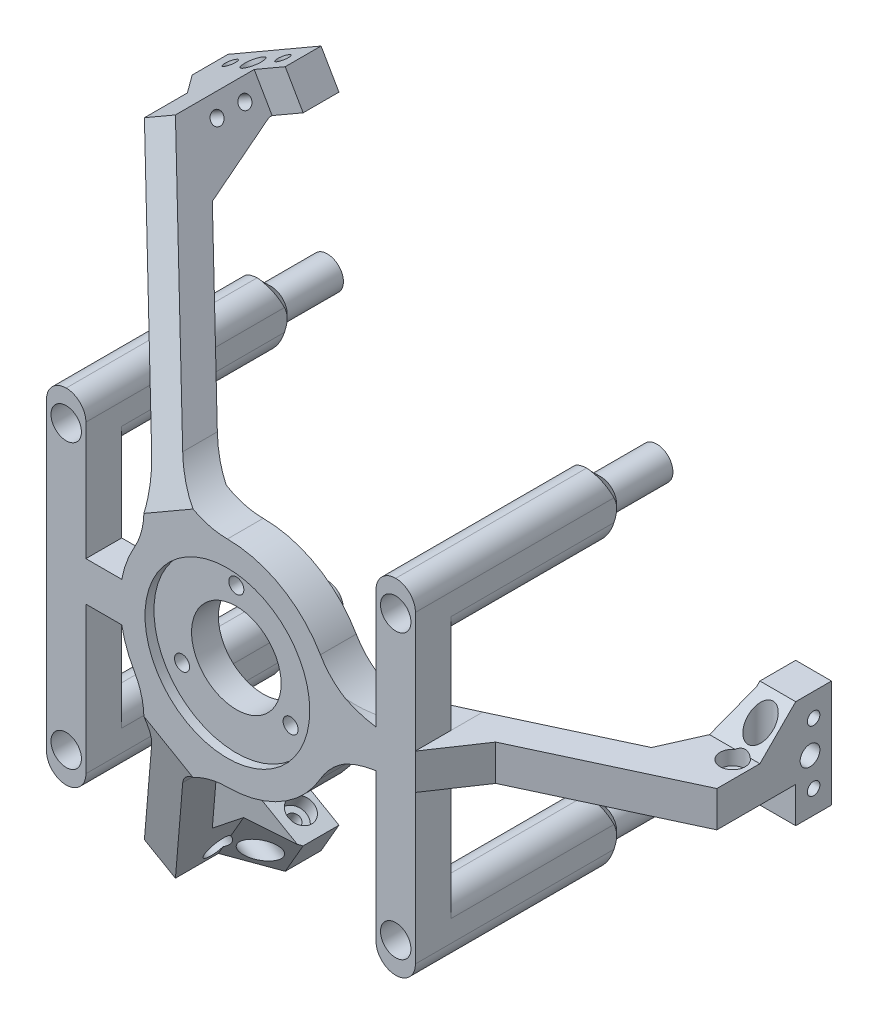
from build123d import *
from OCP.BRepFilletAPI import BRepFilletAPI_MakeChamfer

# Parameters (mm, degrees)
ESQUISSE1_W                    = 10
ESQUISSE1_H                    = 30
BOSS_EXTRU_1_DEPTH             = 10
BOSS_EXTRU_1_2_DEPTH           = 10
BOSS_EXTRU_1_3_DEPTH           = 10
ESQUISSE2_W                    = 10
ESQUISSE2_H                    = 10
BOSS_EXTRU_2_DEPTH             = 45
BOSS_EXTRU_3_DEPTH             = 10
CHANFREIN1_SIZE                = 28
CHANFREIN1_SIZE2               = 60.046193774
CHANFREIN2_SIZE                = 33
CHANFREIN2_SIZE2               = 70.768728377
CONG_1_R                       = 20
CHANFREIN4_SIZE                = 10
CHANFREIN4_SIZE2               = 16.129823564
ENL_V_MAT_EXTRU_1_REACH        = 158.32
ESQUISSE4_R                    = 12.5
ESQUISSE5_R                    = 23
ENL_V_MAT_EXTRU_2_DEPTH        = 2.5
ENL_V_MAT_EXTRU_3_REACH        = 157.297
ESQUISSE6_R                    = 2.1
ESQUISSE7_W                    = 11
ESQUISSE7_H                    = 96
BOSS_EXTRU_4_DEPTH             = 43.3
BOSS_EXTRU_4_DIRECTION_2_REACH = 154.434
ENL_V_MAT_EXTRU_4_REACH        = 153.829
ESQUISSE8_R                    = 4.25
ESQUISSE18_R                   = 4.5
ESQUISSE18_R_2                 = 2.5
BOSS_EXTRU_6_DEPTH             = 17.6
CHANFREIN3_SIZE                = 3.9
ESQUISSE19_R                   = 4.5
ESQUISSE19_R_2                 = 1.5
BOSS_EXTRU_7_DEPTH             = 2
ESQUISSE10_W                   = 21.008475794
ESQUISSE10_H                   = 62
ESQUISSE10_W_2                 = 11
ENL_V_MAT_EXTRU_6_DEPTH        = 43.3
BOSS_EXTRU_5_REACH             = 157.459
CONG_2_R                       = 5.5
BOSS_EXTRU_8_REACH             = 157.122
CHANFREIN6_SIZE                = 10
CHANFREIN6_SIZE_2              = 9.210382888
ENL_V_MAT_EXTRU_7_REACH        = 157.079
ESQUISSE11_R                   = 1.75
ESQUISSE12_R                   = 3.5
ENL_V_MAT_EXTRU_8_DEPTH        = 4
ENL_V_MAT_EXTRU_9_REACH        = 244.289
ESQUISSE13_R                   = 1.75
ESQUISSE14_R                   = 3.5
ENL_V_MAT_EXTRU_10_DEPTH       = 4
ENL_V_MAT_EXTRU_11_REACH       = 244.289
ESQUISSE15_R                   = 2.75
R_P_TITION_CIRCULAIRE1_COUNT   = 3
CHANFREIN5_SIZE                = 10


# Some blends are built 0.0001 mm under size
with BuildPart() as part:
    # Esquisse1 → Boss.-Extru.1 (new body)
    with BuildSketch(Plane.XY):
        with Locations((98.67, 0)):
            Rectangle(ESQUISSE1_W, ESQUISSE1_H)
    extrude(amount=BOSS_EXTRU_1_DEPTH)



with BuildPart() as body_2:
    # Esquisse1 → Boss.-Extru.1 2 (new body)
    with BuildSketch(Plane.XY):
        Polygon((-33.844618943, -88.620599572), (-59.825381057, -73.620599572), (-64.825381057, -82.28085361), (-38.844618943, -97.28085361), align=None)
    extrude(amount=BOSS_EXTRU_1_2_DEPTH)


with BuildPart() as body_3:
    # Esquisse1 → Boss.-Extru.1 3 (new body)
    with BuildSketch(Plane.XY):
        Polygon((-59.825381057, 73.620599572), (-33.844618943, 88.620599572), (-38.844618943, 97.28085361), (-64.825381057, 82.28085361), align=None)
    extrude(amount=BOSS_EXTRU_1_3_DEPTH)


with BuildPart() as part_1:
    add(part.part)

    add(body_2.part)  # Boss.-Extru.2 merges body 2

    add(body_3.part)  # Boss.-Extru.2 merges body 3
    # Esquisse2 → Boss.-Extru.2 (add)
    with BuildSketch(Plane.XY.offset(10)):
        Polygon((-47.504872981, 92.28085361), (-56.165127019, 87.28085361), (-51.165127019, 78.620599572), (-42.504872981, 83.620599572), align=None)
        with Locations((98.67, 0)):
            Rectangle(ESQUISSE2_W, ESQUISSE2_H)
        Polygon((-42.504872981, -83.620599572), (-51.165127019, -78.620599572), (-56.165127019, -87.28085361), (-47.504872981, -92.28085361), align=None)
    extrude(amount=BOSS_EXTRU_2_DEPTH)

    # Esquisse3 → Boss.-Extru.3 (add)
    with BuildSketch(Plane.XY.offset(55)):
        with BuildLine():
            Line((103.67, 5), (103.67, -5))
            Line((103.67, -5), (29.580398915, -5))
            ThreePointArc((29.580398915, -5), (15, -25.980762114), (-10.460072439, -28.117376915))
            Line((-10.460072439, -28.117376915), (-47.504872981, -92.28085361))
            Line((-47.504872981, -92.28085361), (-56.165127019, -87.28085361))
            Line((-56.165127019, -87.28085361), (-19.120326477, -23.117376915))
            ThreePointArc((-19.120326477, -23.117376915), (-30, 0), (-19.120326477, 23.117376915))
            Line((-19.120326477, 23.117376915), (-56.165127019, 87.28085361))
            Line((-56.165127019, 87.28085361), (-47.504872981, 92.28085361))
            Line((-47.504872981, 92.28085361), (-10.460072439, 28.117376915))
            ThreePointArc((-10.460072439, 28.117376915), (15, 25.980762114), (29.580398915, 5))
            Line((29.580398915, 5), (103.67, 5))
        make_face()
    extrude(amount=BOSS_EXTRU_3_DEPTH)

    # Chanfrein1: one chamfer whose edges measure the first distance from different faces: ONE call of the kernel's chamfer builder (chamfer() names one face for all edges)
    chanfrein1_edges_1 = [part_1.edges().sort_by_distance(p)[0] for p in [
        (93.67, 0, 55),
    ]]
    chanfrein1_side_1 = [part_1.faces().sort_by_distance(p)[0] for p in [
        (93.67, 0, 21.5),
    ]]
    chanfrein1_edges_2 = [part_1.edges().sort_by_distance(p)[0] for p in [
        (-46.835, -81.120599572, 55),
    ]]
    chanfrein1_side_2 = [part_1.faces().sort_by_distance(p)[0] for p in [
        (-46.835, -81.120599572, 21.5),
    ]]
    chanfrein1_edges_3 = [part_1.edges().sort_by_distance(p)[0] for p in [
        (-46.835, 81.120599572, 55),
    ]]
    chanfrein1_side_3 = [part_1.faces().sort_by_distance(p)[0] for p in [
        (-46.835, 81.120599572, 21.5),
    ]]
    chanfrein1 = BRepFilletAPI_MakeChamfer(part_1.part.solid().wrapped)
    for e in chanfrein1_edges_1:
        chanfrein1.Add(CHANFREIN1_SIZE, CHANFREIN1_SIZE2, e.wrapped, chanfrein1_side_1[0].wrapped)  # the first distance lies on this face
    for e in chanfrein1_edges_2:
        chanfrein1.Add(CHANFREIN1_SIZE, CHANFREIN1_SIZE2, e.wrapped, chanfrein1_side_2[0].wrapped)  # the first distance lies on this face
    for e in chanfrein1_edges_3:
        chanfrein1.Add(CHANFREIN1_SIZE, CHANFREIN1_SIZE2, e.wrapped, chanfrein1_side_3[0].wrapped)  # the first distance lies on this face
    add(Compound.cast(chanfrein1.Shape()), mode=Mode.REPLACE)

    # Chanfrein2: one chamfer whose edges measure the first distance from different faces: ONE call of the kernel's chamfer builder (chamfer() names one face for all edges)
    chanfrein2_edges_1 = [part_1.edges().sort_by_distance(p)[0] for p in [
        (-51.835, 89.78085361, 65),
    ]]
    chanfrein2_side_1 = [part_1.faces().sort_by_distance(p)[0] for p in [
        (-51.835, 89.78085361, 26.029411765),
    ]]
    chanfrein2_edges_2 = [part_1.edges().sort_by_distance(p)[0] for p in [
        (-51.835, -89.78085361, 65),
    ]]
    chanfrein2_side_2 = [part_1.faces().sort_by_distance(p)[0] for p in [
        (-51.835, -89.78085361, 26.029411765),
    ]]
    chanfrein2_edges_3 = [part_1.edges().sort_by_distance(p)[0] for p in [
        (103.67, 0, 65),
    ]]
    chanfrein2_side_3 = [part_1.faces().sort_by_distance(p)[0] for p in [
        (103.67, 0, 26.029411765),
    ]]
    chanfrein2 = BRepFilletAPI_MakeChamfer(part_1.part.solid().wrapped)
    for e in chanfrein2_edges_1:
        chanfrein2.Add(CHANFREIN2_SIZE, CHANFREIN2_SIZE2, e.wrapped, chanfrein2_side_1[0].wrapped)  # the first distance lies on this face
    for e in chanfrein2_edges_2:
        chanfrein2.Add(CHANFREIN2_SIZE, CHANFREIN2_SIZE2, e.wrapped, chanfrein2_side_2[0].wrapped)  # the first distance lies on this face
    for e in chanfrein2_edges_3:
        chanfrein2.Add(CHANFREIN2_SIZE, CHANFREIN2_SIZE2, e.wrapped, chanfrein2_side_3[0].wrapped)  # the first distance lies on this face
    add(Compound.cast(chanfrein2.Shape()), mode=Mode.REPLACE)

    # Congé1
    # the kernel refuses this fillet: 20 mm, written as the material it adds along each edge
    with BuildSketch(Plane(origin=(29.580398915, -5, 55), x_dir=(1, 0, 0), z_dir=(0, 0, 1))) as cong_1_piece_1_section:
        with BuildLine():
            CenterArc((13.720871274, -20), CONG_1_R, 90, 60)
            ThreePointArc((-3.599636802, -10), (-1.353449847, -5.160676467), (0, 0))
            Line((0, 0), (13.720871274, 0))
        make_face()
    cong_1_piece_1 = extrude(amount=10, mode=Mode.PRIVATE)
    cong_1_piece_1 = split(cong_1_piece_1, bisect_by=Plane(origin=(29.686956687, -8.874488786, 56.835783089), z_dir=(-0.42261826174069717, 0, -0.9063077870366512)), keep=Keep.TOP, mode=Mode.PRIVATE)
    add(cong_1_piece_1)
    with BuildSketch(Plane(origin=(29.580398915, -5, 20.697821816), x_dir=(1, 0, 0), z_dir=(0, 0, 1))) as cong_1_piece_2_section:
        with BuildLine():
            CenterArc((13.720871274, -20), CONG_1_R, 90, 60)
            ThreePointArc((-3.599636802, -10), (-1.353449847, -5.160676467), (0, 0))
            Line((0, 0), (13.720871274, 0))
        make_face()
    cong_1_piece_2 = extrude(amount=44.302178184, mode=Mode.PRIVATE)
    cong_1_piece_2 = split(cong_1_piece_2, bisect_by=Plane(origin=(38.771114589, -5.14420789, 55), z_dir=(0, 0, -1)), keep=Keep.TOP, mode=Mode.PRIVATE)
    cong_1_piece_2 = split(cong_1_piece_2, bisect_by=Plane(origin=(38.311444008, -5.14420789, 52.814118603), z_dir=(0.42261826174069717, 0, 0.9063077870366512)), keep=Keep.TOP, mode=Mode.PRIVATE)
    add(cong_1_piece_2)
    with BuildSketch(Plane(origin=(29.580398915, -5, 55), x_dir=(1, 0, 0), z_dir=(0, 0, 1))) as cong_1_piece_3_section:
        with BuildLine():
            CenterArc((13.720871274, -20), CONG_1_R, 90, 60)
            ThreePointArc((-3.599636802, -10), (-1.353449847, -5.160676467), (0, 0))
            Line((0, 0), (13.720871274, 0))
        make_face()
    cong_1_piece_3 = extrude(amount=10, mode=Mode.PRIVATE)
    cong_1_piece_3 = split(cong_1_piece_3, bisect_by=Plane(origin=(34.156961746, -7.089474208, 64.41446208), z_dir=(-0.42261826174069717, 0, -0.906307787036651)), keep=Keep.TOP, mode=Mode.PRIVATE)
    cong_1_piece_3 = split(cong_1_piece_3, bisect_by=Plane(origin=(30.455788686, -7.089474208, 56.47727084), z_dir=(0.42261826174069717, 0, 0.9063077870366512)), keep=Keep.TOP, mode=Mode.PRIVATE)
    add(cong_1_piece_3)
    with BuildSketch(Plane(origin=(-10.460072439, -28.117376915, 20.697821816), x_dir=(0.984186439950099, -0.17713568646196043, 0), z_dir=(0, 0, 1))) as cong_1_piece_4_section:
        with BuildLine():
            CenterArc((14.170854917, -19.683728799), CONG_1_R, 100.202965887, 60)
            Line((-4.647111129, -12.909944487), (0, 0))
            ThreePointArc((0, 0), (5.314070594, -0.474406801), (10.628141188, 0))
        make_face()
    cong_1_piece_4 = extrude(amount=44.302178184, mode=Mode.PRIVATE)
    cong_1_piece_4 = split(cong_1_piece_4, bisect_by=Plane(origin=(-14.930542581, -36.148874113, 55), z_dir=(0, 0, -1)), keep=Keep.TOP, mode=Mode.PRIVATE)
    cong_1_piece_4 = split(cong_1_piece_4, bisect_by=Plane(origin=(-14.700707291, -35.750787713, 52.814118603), z_dir=(-0.21130913087034803, -0.3659981507706655, 0.906307787036651)), keep=Keep.TOP, mode=Mode.PRIVATE)
    add(cong_1_piece_4)
    with BuildSketch(Plane(origin=(-10.460072439, -28.117376915, 55), x_dir=(0.9841864399500992, -0.17713568646195998, 0), z_dir=(0, 0, 1))) as cong_1_piece_5_section:
        with BuildLine():
            CenterArc((14.170854917, -19.683728799), CONG_1_R, 100.202965887, 60)
            Line((-4.647111129, -12.909944487), (0, 0))
            ThreePointArc((0, 0), (5.314070594, -0.474406801), (10.628141188, 0))
        make_face()
    cong_1_piece_5 = extrude(amount=10, mode=Mode.PRIVATE)
    cong_1_piece_5 = split(cong_1_piece_5, bisect_by=Plane(origin=(-7.157945608, -30.146903047, 56.835783088), z_dir=(0.21130913087034803, 0.3659981507706655, -0.906307787036651)), keep=Keep.TOP, mode=Mode.PRIVATE)
    add(cong_1_piece_5)
    with BuildSketch(Plane(origin=(-10.460072439, -28.117376915, 55), x_dir=(0.9841864399500992, -0.17713568646195998, 0), z_dir=(0, 0, 1))) as cong_1_piece_6_section:
        with BuildLine():
            CenterArc((14.170854917, -19.683728799), CONG_1_R, 100.202965887, 60)
            Line((-4.647111129, -12.909944487), (0, 0))
            ThreePointArc((0, 0), (5.314070594, -0.474406801), (10.628141188, 0))
        make_face()
    cong_1_piece_6 = extrude(amount=10, mode=Mode.PRIVATE)
    cong_1_piece_6 = split(cong_1_piece_6, bisect_by=Plane(origin=(-10.938816109, -33.125533693, 64.414462079), z_dir=(0.21130913087034933, 0.3659981507706645, -0.906307787036651)), keep=Keep.TOP, mode=Mode.PRIVATE)
    cong_1_piece_6 = split(cong_1_piece_6, bisect_by=Plane(origin=(-9.088229579, -29.9202238, 56.477270839), z_dir=(-0.21130913087034803, -0.3659981507706655, 0.906307787036651)), keep=Keep.TOP, mode=Mode.PRIVATE)
    add(cong_1_piece_6)
    with BuildSketch(Plane(origin=(-19.120326477, -23.117376915, 20.697821816), x_dir=(-0.6454972243679025, 0.7637626158259736, 0), z_dir=(0, 0, 1))) as cong_1_piece_7_section:
        with BuildLine():
            CenterArc((14.170854917, 19.683728799), CONG_1_R, 199.797034113, 60)
            Line((-4.647111129, 12.909944487), (0, 0))
            ThreePointArc((0, 0), (5.314070594, 0.474406801), (10.628141188, 0))
        make_face()
    cong_1_piece_7 = extrude(amount=44.302178184, mode=Mode.PRIVATE)
    cong_1_piece_7 = split(cong_1_piece_7, bisect_by=Plane(origin=(-23.84057201, -31.004666224, 55), z_dir=(0, 0, -1)), keep=Keep.TOP, mode=Mode.PRIVATE)
    cong_1_piece_7 = split(cong_1_piece_7, bisect_by=Plane(origin=(-23.610736719, -30.606579824, 52.814118603), z_dir=(-0.21130913087034803, -0.3659981507706655, 0.906307787036651)), keep=Keep.TOP, mode=Mode.PRIVATE)
    add(cong_1_piece_7)
    with BuildSketch(Plane(origin=(-19.120326477, -23.117376915, 55), x_dir=(-0.6454972243679029, 0.7637626158259734, 0), z_dir=(0, 0, 1))) as cong_1_piece_8_section:
        with BuildLine():
            CenterArc((14.170854917, 19.683728799), CONG_1_R, 199.797034113, 60)
            Line((-4.647111129, 12.909944487), (0, 0))
            ThreePointArc((0, 0), (5.314070594, 0.474406801), (10.628141188, 0))
        make_face()
    cong_1_piece_8 = extrude(amount=10, mode=Mode.PRIVATE)
    cong_1_piece_8 = split(cong_1_piece_8, bisect_by=Plane(origin=(-22.529011081, -21.272414259, 56.835783088), z_dir=(0.21130913087034803, 0.3659981507706655, -0.906307787036651)), keep=Keep.TOP, mode=Mode.PRIVATE)
    add(cong_1_piece_8)
    with BuildSketch(Plane(origin=(-19.120326477, -23.117376915, 55), x_dir=(-0.6454972243679029, 0.7637626158259734, 0), z_dir=(0, 0, 1))) as cong_1_piece_9_section:
        with BuildLine():
            CenterArc((14.170854917, 19.683728799), CONG_1_R, 199.797034113, 60)
            Line((-4.647111129, 12.909944487), (0, 0))
            ThreePointArc((0, 0), (5.314070594, 0.474406801), (10.628141188, 0))
        make_face()
    cong_1_piece_9 = extrude(amount=10, mode=Mode.PRIVATE)
    cong_1_piece_9 = split(cong_1_piece_9, bisect_by=Plane(origin=(-23.218145637, -26.036059484, 64.414462079), z_dir=(0.21130913087034933, 0.3659981507706645, -0.906307787036651)), keep=Keep.TOP, mode=Mode.PRIVATE)
    cong_1_piece_9 = split(cong_1_piece_9, bisect_by=Plane(origin=(-21.367559108, -22.830749591, 56.477270839), z_dir=(-0.21130913087034803, -0.3659981507706655, 0.906307787036651)), keep=Keep.TOP, mode=Mode.PRIVATE)
    add(cong_1_piece_9)
    with BuildSketch(Plane(origin=(-19.120326477, 23.117376915, 55), x_dir=(-0.4999999999999981, 0.8660254037844398, 0), z_dir=(0, 0, 1))) as cong_1_piece_10_section:
        with BuildLine():
            CenterArc((13.720871274, 20), CONG_1_R, 210, 60)
            ThreePointArc((-3.599636802, 10), (-1.353449847, 5.160676467), (0, 0))
            Line((0, 0), (13.720871274, 0))
        make_face()
    cong_1_piece_10 = extrude(amount=10, mode=Mode.PRIVATE)
    cong_1_piece_10 = split(cong_1_piece_10, bisect_by=Plane(origin=(-22.529011078, 21.272414259, 56.835783089), z_dir=(0.21130913087034867, -0.36599815077066483, -0.906307787036651)), keep=Keep.TOP, mode=Mode.PRIVATE)
    add(cong_1_piece_10)
    with BuildSketch(Plane(origin=(-19.120326477, 23.117376915, 20.697821816), x_dir=(-0.5000000000000007, 0.8660254037844383, 0), z_dir=(0, 0, 1))) as cong_1_piece_11_section:
        with BuildLine():
            CenterArc((13.720871274, 20), CONG_1_R, 210, 60)
            ThreePointArc((-3.599636802, 10), (-1.353449847, 5.160676467), (0, 0))
            Line((0, 0), (13.720871274, 0))
        make_face()
    cong_1_piece_11 = extrude(amount=44.302178184, mode=Mode.PRIVATE)
    cong_1_piece_11 = split(cong_1_piece_11, bisect_by=Plane(origin=(-23.84057201, 31.004666222, 55), z_dir=(0, 0, -1)), keep=Keep.TOP, mode=Mode.PRIVATE)
    cong_1_piece_11 = split(cong_1_piece_11, bisect_by=Plane(origin=(-23.610736719, 30.606579822, 52.814118603), z_dir=(-0.21130913087034867, 0.36599815077066483, 0.906307787036651)), keep=Keep.TOP, mode=Mode.PRIVATE)
    add(cong_1_piece_11)
    with BuildSketch(Plane(origin=(-19.120326477, 23.117376915, 55), x_dir=(-0.4999999999999981, 0.8660254037844398, 0), z_dir=(0, 0, 1))) as cong_1_piece_12_section:
        with BuildLine():
            CenterArc((13.720871274, 20), CONG_1_R, 210, 60)
            ThreePointArc((-3.599636802, 10), (-1.353449847, 5.160676467), (0, 0))
            Line((0, 0), (13.720871274, 0))
        make_face()
    cong_1_piece_12 = extrude(amount=10, mode=Mode.PRIVATE)
    cong_1_piece_12 = split(cong_1_piece_12, bisect_by=Plane(origin=(-23.218145636, 26.036059484, 64.41446208), z_dir=(0.2113091308703489, -0.36599815077066467, -0.906307787036651)), keep=Keep.TOP, mode=Mode.PRIVATE)
    cong_1_piece_12 = split(cong_1_piece_12, bisect_by=Plane(origin=(-21.367559107, 22.830749591, 56.47727084), z_dir=(-0.21130913087034867, 0.36599815077066483, 0.906307787036651)), keep=Keep.TOP, mode=Mode.PRIVATE)
    add(cong_1_piece_12)
    with BuildSketch(Plane(origin=(29.580398915, 5, 55), x_dir=(1, 0, 0), z_dir=(0, 0, 1))) as cong_1_piece_13_section:
        with BuildLine():
            CenterArc((13.720871274, 20), CONG_1_R, 210, 60)
            ThreePointArc((-3.599636802, 10), (-1.353449847, 5.160676467), (0, 0))
            Line((0, 0), (13.720871274, 0))
        make_face()
    cong_1_piece_13 = extrude(amount=10, mode=Mode.PRIVATE)
    cong_1_piece_13 = split(cong_1_piece_13, bisect_by=Plane(origin=(29.686956687, 8.874488786, 56.835783089), z_dir=(-0.42261826174069717, 0, -0.9063077870366512)), keep=Keep.TOP, mode=Mode.PRIVATE)
    add(cong_1_piece_13)
    with BuildSketch(Plane(origin=(29.580398915, 5, 20.697821816), x_dir=(1, 0, 0), z_dir=(0, 0, 1))) as cong_1_piece_14_section:
        with BuildLine():
            CenterArc((13.720871274, 20), CONG_1_R, 210, 60)
            ThreePointArc((-3.599636802, 10), (-1.353449847, 5.160676467), (0, 0))
            Line((0, 0), (13.720871274, 0))
        make_face()
    cong_1_piece_14 = extrude(amount=44.302178184, mode=Mode.PRIVATE)
    cong_1_piece_14 = split(cong_1_piece_14, bisect_by=Plane(origin=(38.771114589, 5.14420789, 55), z_dir=(0, 0, -1)), keep=Keep.TOP, mode=Mode.PRIVATE)
    cong_1_piece_14 = split(cong_1_piece_14, bisect_by=Plane(origin=(38.311444008, 5.14420789, 52.814118603), z_dir=(0.42261826174069717, 0, 0.9063077870366512)), keep=Keep.TOP, mode=Mode.PRIVATE)
    add(cong_1_piece_14)
    with BuildSketch(Plane(origin=(29.580398915, 5, 55), x_dir=(1, 0, 0), z_dir=(0, 0, 1))) as cong_1_piece_15_section:
        with BuildLine():
            CenterArc((13.720871274, 20), CONG_1_R, 210, 60)
            ThreePointArc((-3.599636802, 10), (-1.353449847, 5.160676467), (0, 0))
            Line((0, 0), (13.720871274, 0))
        make_face()
    cong_1_piece_15 = extrude(amount=10, mode=Mode.PRIVATE)
    cong_1_piece_15 = split(cong_1_piece_15, bisect_by=Plane(origin=(34.156961746, 7.089474208, 64.41446208), z_dir=(-0.42261826174069717, 0, -0.906307787036651)), keep=Keep.TOP, mode=Mode.PRIVATE)
    cong_1_piece_15 = split(cong_1_piece_15, bisect_by=Plane(origin=(30.455788686, 7.089474208, 56.47727084), z_dir=(0.42261826174069717, 0, 0.9063077870366512)), keep=Keep.TOP, mode=Mode.PRIVATE)
    add(cong_1_piece_15)
    with BuildSketch(Plane(origin=(-10.460072439, 28.117376915, 20.697821816), x_dir=(0.9841864399500989, 0.17713568646196104, 0), z_dir=(0, 0, 1))) as cong_1_piece_16_section:
        with BuildLine():
            CenterArc((14.170854917, 19.683728799), CONG_1_R, 199.797034113, 60)
            Line((-4.647111129, 12.909944487), (0, 0))
            ThreePointArc((0, 0), (5.314070594, 0.474406801), (10.628141188, 0))
        make_face()
    cong_1_piece_16 = extrude(amount=44.302178184, mode=Mode.PRIVATE)
    cong_1_piece_16 = split(cong_1_piece_16, bisect_by=Plane(origin=(-14.930542581, 36.148874113, 55), z_dir=(0, 0, -1)), keep=Keep.TOP, mode=Mode.PRIVATE)
    cong_1_piece_16 = split(cong_1_piece_16, bisect_by=Plane(origin=(-14.700707291, 35.750787713, 52.814118603), z_dir=(-0.21130913087034867, 0.36599815077066483, 0.906307787036651)), keep=Keep.TOP, mode=Mode.PRIVATE)
    add(cong_1_piece_16)
    with BuildSketch(Plane(origin=(-10.460072439, 28.117376915, 55), x_dir=(0.9841864399500989, 0.1771356864619613, 0), z_dir=(0, 0, 1))) as cong_1_piece_17_section:
        with BuildLine():
            CenterArc((14.170854917, 19.683728799), CONG_1_R, 199.797034113, 60)
            Line((-4.647111129, 12.909944487), (0, 0))
            ThreePointArc((0, 0), (5.314070594, 0.474406801), (10.628141188, 0))
        make_face()
    cong_1_piece_17 = extrude(amount=10, mode=Mode.PRIVATE)
    cong_1_piece_17 = split(cong_1_piece_17, bisect_by=Plane(origin=(-7.157945608, 30.146903047, 56.835783088), z_dir=(0.21130913087034867, -0.36599815077066483, -0.906307787036651)), keep=Keep.TOP, mode=Mode.PRIVATE)
    add(cong_1_piece_17)
    with BuildSketch(Plane(origin=(-10.460072439, 28.117376915, 55), x_dir=(0.9841864399500989, 0.1771356864619613, 0), z_dir=(0, 0, 1))) as cong_1_piece_18_section:
        with BuildLine():
            CenterArc((14.170854917, 19.683728799), CONG_1_R, 199.797034113, 60)
            Line((-4.647111129, 12.909944487), (0, 0))
            ThreePointArc((0, 0), (5.314070594, 0.474406801), (10.628141188, 0))
        make_face()
    cong_1_piece_18 = extrude(amount=10, mode=Mode.PRIVATE)
    cong_1_piece_18 = split(cong_1_piece_18, bisect_by=Plane(origin=(-10.938816109, 33.125533693, 64.414462079), z_dir=(0.2113091308703489, -0.36599815077066467, -0.906307787036651)), keep=Keep.TOP, mode=Mode.PRIVATE)
    cong_1_piece_18 = split(cong_1_piece_18, bisect_by=Plane(origin=(-9.088229579, 29.9202238, 56.477270839), z_dir=(-0.21130913087034867, 0.36599815077066483, 0.906307787036651)), keep=Keep.TOP, mode=Mode.PRIVATE)
    add(cong_1_piece_18)

    # Chanfrein4: one chamfer whose edges measure the first distance from different faces: ONE call of the kernel's chamfer builder (chamfer() names one face for all edges)
    chanfrein4_edges_1 = [part_1.edges().sort_by_distance(p)[0] for p in [
        (93.67, 0, 27),
    ]]
    chanfrein4_side_1 = [part_1.faces().sort_by_distance(p)[0] for p in [
        (62.943360547, 0, 41.328067286),
    ]]
    chanfrein4_edges_2 = [part_1.edges().sort_by_distance(p)[0] for p in [
        (-46.835, -81.120599572, 27),
    ]]
    chanfrein4_side_2 = [part_1.faces().sort_by_distance(p)[0] for p in [
        (-31.471680274, -54.510549234, 41.328067286),
    ]]
    chanfrein4_edges_3 = [part_1.edges().sort_by_distance(p)[0] for p in [
        (-46.835, 81.120599572, 27),
    ]]
    chanfrein4_side_3 = [part_1.faces().sort_by_distance(p)[0] for p in [
        (-31.471680274, 54.510549234, 41.328067286),
    ]]
    chanfrein4 = BRepFilletAPI_MakeChamfer(part_1.part.solid().wrapped)
    for e in chanfrein4_edges_1:
        chanfrein4.Add(CHANFREIN4_SIZE, CHANFREIN4_SIZE2, e.wrapped, chanfrein4_side_1[0].wrapped)  # the first distance lies on this face
    for e in chanfrein4_edges_2:
        chanfrein4.Add(CHANFREIN4_SIZE, CHANFREIN4_SIZE2, e.wrapped, chanfrein4_side_2[0].wrapped)  # the first distance lies on this face
    for e in chanfrein4_edges_3:
        chanfrein4.Add(CHANFREIN4_SIZE, CHANFREIN4_SIZE2, e.wrapped, chanfrein4_side_3[0].wrapped)  # the first distance lies on this face
    add(Compound.cast(chanfrein4.Shape()), mode=Mode.REPLACE)

    # Esquisse4 → Enlèv. mat.-Extru.1 (cut, up to next)
    with BuildSketch(Plane.XY.offset(65), mode=Mode.PRIVATE) as enl_v_mat_extru_1_sk1:
        Circle(ESQUISSE4_R)
    enl_v_mat_extru_1_tool1 = extrude(enl_v_mat_extru_1_sk1.sketch, amount=-ENL_V_MAT_EXTRU_1_REACH, mode=Mode.PRIVATE) & part_1.part
    add(enl_v_mat_extru_1_tool1.solids().sort_by_distance((0, 0, 65))[0], mode=Mode.SUBTRACT)

    # Esquisse5 → Enlèv. mat.-Extru.2 (cut)
    with BuildSketch(Plane.XY.offset(65)):
        Circle(ESQUISSE5_R)
    extrude(amount=-ENL_V_MAT_EXTRU_2_DEPTH, mode=Mode.SUBTRACT)

    # Esquisse6 → Enlèv. mat.-Extru.3 (cut, up to next)
    with BuildSketch(Plane.XY.offset(62.5), mode=Mode.PRIVATE) as enl_v_mat_extru_3_sk1:
        with Locations((0, 17.5)):
            Circle(ESQUISSE6_R)
    enl_v_mat_extru_3_tool1 = extrude(enl_v_mat_extru_3_sk1.sketch, amount=-ENL_V_MAT_EXTRU_3_REACH, mode=Mode.PRIVATE) & part_1.part
    # Esquisse6 → Enlèv. mat.-Extru.3 (cut, up to next)
    with BuildSketch(Plane.XY.offset(62.5), mode=Mode.PRIVATE) as enl_v_mat_extru_3_sk2:
        with Locations((15.155444566, -8.75)):
            Circle(ESQUISSE6_R)
    enl_v_mat_extru_3_tool2 = extrude(enl_v_mat_extru_3_sk2.sketch, amount=-ENL_V_MAT_EXTRU_3_REACH, mode=Mode.PRIVATE) & part_1.part
    # Esquisse6 → Enlèv. mat.-Extru.3 (cut, up to next)
    with BuildSketch(Plane.XY.offset(62.5), mode=Mode.PRIVATE) as enl_v_mat_extru_3_sk3:
        with Locations((-15.155444566, -8.75)):
            Circle(ESQUISSE6_R)
    enl_v_mat_extru_3_tool3 = extrude(enl_v_mat_extru_3_sk3.sketch, amount=-ENL_V_MAT_EXTRU_3_REACH, mode=Mode.PRIVATE) & part_1.part
    add(enl_v_mat_extru_3_tool1.solids().sort_by_distance((0, 17.5, 62.5))[0], mode=Mode.SUBTRACT)
    add(enl_v_mat_extru_3_tool2.solids().sort_by_distance((15.155445, -8.75, 62.5))[0], mode=Mode.SUBTRACT)
    add(enl_v_mat_extru_3_tool3.solids().sort_by_distance((-15.155445, -8.75, 62.5))[0], mode=Mode.SUBTRACT)

    # Esquisse7 → Boss.-Extru.4 (add)
    with BuildSketch(Plane(origin=(0, 0, 55), x_dir=(-1, 0, 0), z_dir=(0, 0, -1))):
        with Locations((-47, -4)):
            Rectangle(ESQUISSE7_W, ESQUISSE7_H)
        with BuildLine():
            Line((50.5, -52), (39.5, -52))
            Line((39.5, -52), (39.5, -5.5))
            Line((39.5, -5.5), (29.491524206, -5.5))
            ThreePointArc((29.491524206, -5.5), (30, 0), (29.491524206, 5.5))
            Line((29.491524206, 5.5), (39.5, 5.5))
            Line((39.5, 5.5), (39.5, 44))
            Line((39.5, 44), (50.5, 44))
            Line((50.5, 44), (50.5, -52))
        make_face()
    extrude(amount=BOSS_EXTRU_4_DEPTH)

    # Boss.-Extru.4 direction 2: up to this face of the body (flat: up to its plane)
    boss_extru_4_direction_2_end = Plane(part_1.part.faces().sort_by_distance((-10.405638932, 30.939769239, 65))[0])
    # Esquisse7 → Boss.-Extru.4 direction 2 (add, up to the picked face)
    with BuildSketch(Plane(origin=(0, 0, 55), x_dir=(-1, 0, 0), z_dir=(0, 0, -1)), mode=Mode.PRIVATE) as boss_extru_4_direction_2_sk1:
        with Locations((-47, -4)):
            Rectangle(ESQUISSE7_W, ESQUISSE7_H)
    boss_extru_4_direction_2_tool1 = split(extrude(boss_extru_4_direction_2_sk1.sketch, amount=-BOSS_EXTRU_4_DIRECTION_2_REACH, mode=Mode.PRIVATE), bisect_by=boss_extru_4_direction_2_end, keep=Keep.BOTH, mode=Mode.PRIVATE)
    # Esquisse7 → Boss.-Extru.4 direction 2 (add, up to the picked face)
    with BuildSketch(Plane(origin=(0, 0, 55), x_dir=(-1, 0, 0), z_dir=(0, 0, -1)), mode=Mode.PRIVATE) as boss_extru_4_direction_2_sk2:
        with BuildLine():
            Line((50.5, -52), (39.5, -52))
            Line((39.5, -52), (39.5, -5.5))
            Line((39.5, -5.5), (29.491524206, -5.5))
            ThreePointArc((29.491524206, -5.5), (30, 0), (29.491524206, 5.5))
            Line((29.491524206, 5.5), (39.5, 5.5))
            Line((39.5, 5.5), (39.5, 44))
            Line((39.5, 44), (50.5, 44))
            Line((50.5, 44), (50.5, -52))
        make_face()
    boss_extru_4_direction_2_tool2 = split(extrude(boss_extru_4_direction_2_sk2.sketch, amount=-BOSS_EXTRU_4_DIRECTION_2_REACH, mode=Mode.PRIVATE), bisect_by=boss_extru_4_direction_2_end, keep=Keep.BOTH, mode=Mode.PRIVATE)
    add(boss_extru_4_direction_2_tool1.solids().sort_by(Axis((47, -4, 55), (0, 0, 1)))[0])
    add(boss_extru_4_direction_2_tool2.solids().sort_by(Axis((-44.054268, -3.633992, 55), (0, 0, 1)))[0])

    # Esquisse8 → Enlèv. mat.-Extru.4 (cut, up to next)
    with BuildSketch(Plane(origin=(0, 0, 11.7), x_dir=(-1, 0, 0), z_dir=(0, 0, -1)), mode=Mode.PRIVATE) as enl_v_mat_extru_4_sk1:
        with Locations((45, 35.5)):
            Circle(ESQUISSE8_R)
    enl_v_mat_extru_4_tool1 = extrude(enl_v_mat_extru_4_sk1.sketch, amount=-ENL_V_MAT_EXTRU_4_REACH, mode=Mode.PRIVATE) & part_1.part
    # Esquisse8 → Enlèv. mat.-Extru.4 (cut, up to next)
    with BuildSketch(Plane(origin=(0, 0, 11.7), x_dir=(-1, 0, 0), z_dir=(0, 0, -1)), mode=Mode.PRIVATE) as enl_v_mat_extru_4_sk2:
        with Locations((-47, 35.5)):
            Circle(ESQUISSE8_R)
    enl_v_mat_extru_4_tool2 = extrude(enl_v_mat_extru_4_sk2.sketch, amount=-ENL_V_MAT_EXTRU_4_REACH, mode=Mode.PRIVATE) & part_1.part
    # Esquisse8 → Enlèv. mat.-Extru.4 (cut, up to next)
    with BuildSketch(Plane(origin=(0, 0, 11.7), x_dir=(-1, 0, 0), z_dir=(0, 0, -1)), mode=Mode.PRIVATE) as enl_v_mat_extru_4_sk3:
        with Locations((-47, -43.5)):
            Circle(ESQUISSE8_R)
    enl_v_mat_extru_4_tool3 = extrude(enl_v_mat_extru_4_sk3.sketch, amount=-ENL_V_MAT_EXTRU_4_REACH, mode=Mode.PRIVATE) & part_1.part
    # Esquisse8 → Enlèv. mat.-Extru.4 (cut, up to next)
    with BuildSketch(Plane(origin=(0, 0, 11.7), x_dir=(-1, 0, 0), z_dir=(0, 0, -1)), mode=Mode.PRIVATE) as enl_v_mat_extru_4_sk4:
        with Locations((45, -43.5)):
            Circle(ESQUISSE8_R)
    enl_v_mat_extru_4_tool4 = extrude(enl_v_mat_extru_4_sk4.sketch, amount=-ENL_V_MAT_EXTRU_4_REACH, mode=Mode.PRIVATE) & part_1.part
    add(enl_v_mat_extru_4_tool1.solids().sort_by_distance((-45, 35.5, 11.7))[0], mode=Mode.SUBTRACT)
    add(enl_v_mat_extru_4_tool2.solids().sort_by_distance((47, 35.5, 11.7))[0], mode=Mode.SUBTRACT)
    add(enl_v_mat_extru_4_tool3.solids().sort_by_distance((47, -43.5, 11.7))[0], mode=Mode.SUBTRACT)
    add(enl_v_mat_extru_4_tool4.solids().sort_by_distance((-45, -43.5, 11.7))[0], mode=Mode.SUBTRACT)

    # Esquisse18 → Boss.-Extru.6 (add)
    # profile 1 of 4: a face of its own
    with BuildSketch(Plane(origin=(0, 0, 11.7), x_dir=(-1, 0, 0), z_dir=(0, 0, -1))):
        with Locations((-47, 35.5)):
            Circle(ESQUISSE18_R)
        with Locations((-47, 35.5)):
            Circle(ESQUISSE18_R_2, mode=Mode.SUBTRACT)
    # profile 2 of 4: a face of its own
    with BuildSketch(Plane(origin=(0, 0, 11.7), x_dir=(-1, 0, 0), z_dir=(0, 0, -1))):
        with Locations((-47, -43.5)):
            Circle(ESQUISSE18_R)
        with Locations((-47, -43.5)):
            Circle(ESQUISSE18_R_2, mode=Mode.SUBTRACT)
    # profile 3 of 4: a face of its own
    with BuildSketch(Plane(origin=(0, 0, 11.7), x_dir=(-1, 0, 0), z_dir=(0, 0, -1))):
        with Locations((45, 35.5)):
            Circle(ESQUISSE18_R)
        with Locations((45, 35.5)):
            Circle(ESQUISSE18_R_2, mode=Mode.SUBTRACT)
    # profile 4 of 4: a face of its own
    with BuildSketch(Plane(origin=(0, 0, 11.7), x_dir=(-1, 0, 0), z_dir=(0, 0, -1))):
        with Locations((45, -43.5)):
            Circle(ESQUISSE18_R)
        with Locations((45, -43.5)):
            Circle(ESQUISSE18_R_2, mode=Mode.SUBTRACT)
    extrude(amount=BOSS_EXTRU_6_DEPTH)

    # Chanfrein3
    # the kernel refuses this chamfer: 3.9 mm, written as the material it adds along each edge
    with BuildSketch(Plane(origin=(47, 35.5, 11.7), x_dir=(-1, 0, 0), z_dir=(0, -1, 0))) as chanfrein3_piece_1_section:
        Polygon((4.5 + CHANFREIN3_SIZE, 0), (4.5, CHANFREIN3_SIZE), (4.5, 0), align=None)
    chanfrein3_piece_1 = revolve(axis=Axis((47, 35.5, 11.7), (0, 0, -1)), mode=Mode.PRIVATE)
    chanfrein3_piece_1 = split(chanfrein3_piece_1, bisect_by=Plane(origin=(41.5, 42.23727377, 11.167544562), z_dir=(1, 0, 0)), keep=Keep.TOP, mode=Mode.PRIVATE)
    chanfrein3_piece_1 = split(chanfrein3_piece_1, bisect_by=Plane(origin=(52.5, 42.23727377, 11.167544562), z_dir=(-1, 0, 0)), keep=Keep.TOP, mode=Mode.PRIVATE)
    add(chanfrein3_piece_1)
    with BuildSketch(Plane(origin=(47, -43.5, 11.7), x_dir=(-1, 0, 0), z_dir=(0, -1, 0))) as chanfrein3_piece_2_section:
        Polygon((4.5 + CHANFREIN3_SIZE, 0), (4.5, CHANFREIN3_SIZE), (4.5, 0), align=None)
    chanfrein3_piece_2 = revolve(axis=Axis((47, -43.5, 11.7), (0, 0, -1)), mode=Mode.PRIVATE)
    chanfrein3_piece_2 = split(chanfrein3_piece_2, bisect_by=Plane(origin=(41.5, -36.76272623, 11.167544561), z_dir=(1, 0, 0)), keep=Keep.TOP, mode=Mode.PRIVATE)
    chanfrein3_piece_2 = split(chanfrein3_piece_2, bisect_by=Plane(origin=(52.5, -36.76272623, 11.167544561), z_dir=(-1, 0, 0)), keep=Keep.TOP, mode=Mode.PRIVATE)
    add(chanfrein3_piece_2)
    with BuildSketch(Plane(origin=(-45, 35.5, 11.7), x_dir=(-1, 0, 0), z_dir=(0, -1, 0))) as chanfrein3_piece_3_section:
        Polygon((4.5 + CHANFREIN3_SIZE, 0), (4.5, CHANFREIN3_SIZE), (4.5, 0), align=None)
    chanfrein3_piece_3 = revolve(axis=Axis((-45, 35.5, 11.7), (0, 0, -1)), mode=Mode.PRIVATE)
    chanfrein3_piece_3 = split(chanfrein3_piece_3, bisect_by=Plane(origin=(-39.5, 42.23727377, 11.167544561), z_dir=(-1, 0, 0)), keep=Keep.TOP, mode=Mode.PRIVATE)
    chanfrein3_piece_3 = split(chanfrein3_piece_3, bisect_by=Plane(origin=(-50.5, 42.23727377, 11.167544561), z_dir=(1, 0, 0)), keep=Keep.TOP, mode=Mode.PRIVATE)
    add(chanfrein3_piece_3)
    with BuildSketch(Plane(origin=(-45, -43.5, 11.7), x_dir=(-1, 0, 0), z_dir=(0, -1, 0))) as chanfrein3_piece_4_section:
        Polygon((4.5 + CHANFREIN3_SIZE, 0), (4.5, CHANFREIN3_SIZE), (4.5, 0), align=None)
    chanfrein3_piece_4 = revolve(axis=Axis((-45, -43.5, 11.7), (0, 0, -1)), mode=Mode.PRIVATE)
    chanfrein3_piece_4 = split(chanfrein3_piece_4, bisect_by=Plane(origin=(-50.5, -36.76272623, 11.167544562), z_dir=(1, 0, 0)), keep=Keep.TOP, mode=Mode.PRIVATE)
    chanfrein3_piece_4 = split(chanfrein3_piece_4, bisect_by=Plane(origin=(-39.5, -36.76272623, 11.167544562), z_dir=(-1, 0, 0)), keep=Keep.TOP, mode=Mode.PRIVATE)
    add(chanfrein3_piece_4)

    # Esquisse19 → Boss.-Extru.7 (add)
    # profile 1 of 4: a face of its own
    with BuildSketch(Plane(origin=(0, 0, -5.9), x_dir=(-1, 0, 0), z_dir=(0, 0, -1))):
        with Locations((-47, -43.5)):
            Circle(ESQUISSE19_R)
        with Locations((-47, -43.5)):
            Circle(ESQUISSE19_R_2, mode=Mode.SUBTRACT)
    # profile 2 of 4: a face of its own
    with BuildSketch(Plane(origin=(0, 0, -5.9), x_dir=(-1, 0, 0), z_dir=(0, 0, -1))):
        with Locations((-47, 35.5)):
            Circle(ESQUISSE19_R)
        with Locations((-47, 35.5)):
            Circle(ESQUISSE19_R_2, mode=Mode.SUBTRACT)
    # profile 3 of 4: a face of its own
    with BuildSketch(Plane(origin=(0, 0, -5.9), x_dir=(-1, 0, 0), z_dir=(0, 0, -1))):
        with Locations((45, 35.5)):
            Circle(ESQUISSE19_R)
        with Locations((45, 35.5)):
            Circle(ESQUISSE19_R_2, mode=Mode.SUBTRACT)
    # profile 4 of 4: a face of its own
    with BuildSketch(Plane(origin=(0, 0, -5.9), x_dir=(-1, 0, 0), z_dir=(0, 0, -1))):
        with Locations((45, -43.5)):
            Circle(ESQUISSE19_R)
        with Locations((45, -43.5)):
            Circle(ESQUISSE19_R_2, mode=Mode.SUBTRACT)
    extrude(amount=BOSS_EXTRU_7_DEPTH)

    # Esquisse10 → Enlèv. mat.-Extru.6 (cut)
    with BuildSketch(Plane(origin=(0, 0, 11.7), x_dir=(-1, 0, 0), z_dir=(0, 0, -1))):
        with Locations((39.995762103, -4)):
            Rectangle(ESQUISSE10_W, ESQUISSE10_H)
        with Locations((-47, -4)):
            Rectangle(ESQUISSE10_W_2, ESQUISSE10_H)
    extrude(amount=-ENL_V_MAT_EXTRU_6_DEPTH, mode=Mode.SUBTRACT)

    # Boss.-Extru.5: up to this plane
    boss_extru_5_end = Plane(origin=(33.623806226, 0, 55), z_dir=(0.4226182617406939, 0, 0.9063077870366526))
    # Esquisse17 → Boss.-Extru.5 (add, up to the surface)
    with BuildSketch(Plane(origin=(0, 0, 55), x_dir=(-1, 0, 0), z_dir=(0, 0, -1)), mode=Mode.PRIVATE) as boss_extru_5_sk1:
        Polygon((-41.5, -5.081279516), (-52.5, -5), (-52.5, 5), (-41.5, 5.081279516), align=None)
    boss_extru_5_tool1 = split(extrude(boss_extru_5_sk1.sketch, amount=BOSS_EXTRU_5_REACH, mode=Mode.PRIVATE), bisect_by=boss_extru_5_end, keep=Keep.BOTH, mode=Mode.PRIVATE)
    add(boss_extru_5_tool1.solids().sort_by_distance((46.985219, 0, 55))[0])

    # Congé2
    cong_2_edges = [part_1.edges().sort_by_distance(p)[0] for p in [
        (-50.5, 44, 38.35),
        (-39.5, 44, 38.35),
        (41.5, 44, 38.35),
        (52.5, 44, 38.35),
        (-50.5, -52, 38.35),
        (-39.5, -52, 38.35),
        (52.5, -52, 38.35),
        (41.5, -52, 38.35),
        (-50.5, 27, 33.35),
        (-39.5, 27, 33.35),
        (-50.5, -35, 33.35),
        (-39.5, -35, 33.35),
        (41.5, -35, 33.35),
        (52.5, -35, 33.35),
        (41.5, 27, 33.35),
        (52.5, 27, 33.35),
    ]]
    fillet(cong_2_edges, radius=CONG_2_R - 0.0001)  # a hair under: the kernel refuses the full size

    # Boss.-Extru.8: up to this face of the body (flat: up to its plane)
    boss_extru_8_end = Plane(part_1.part.faces().sort_by_distance((47, -4, 65))[0])
    # Esquisse20 → Boss.-Extru.8 (add, up to the picked face)
    with BuildSketch(Plane(origin=(30.772815342, 0, 65.992515464), x_dir=(0.9063077870366497, 0, -0.4226182617407002), z_dir=(0.42261826174070016, 0, 0.9063077870366496)), mode=Mode.PRIVATE) as boss_extru_8_sk1:
        with BuildLine():
            Line((11.836138684, -5.081279516), (11.836138684, 5.081279516))
            add(Edge.make_bspline(
                [(2.348491662, 7.916673924), (6.728805262, 5.499868068), (11.836138684, 5.081279516)],
                knots=[4.165538114, 4.165538114, 4.165538114, 4.622203267, 4.622203267, 4.622203267], degree=2, weights=[1, 0.974045176, 1]))
            Line((2.348491662, 7.916673924), (2.348491662, -7.916673924))
            add(Edge.make_bspline(
                [(11.836138684, -5.081279516), (6.728805262, -5.499868068), (2.348491662, -7.916673924)],
                knots=[1.66098204, 1.66098204, 1.66098204, 2.117647194, 2.117647194, 2.117647194], degree=2, weights=[1, 0.974045176, 1]))
        make_face()
    boss_extru_8_tool1 = split(extrude(boss_extru_8_sk1.sketch, amount=BOSS_EXTRU_8_REACH, mode=Mode.PRIVATE), bisect_by=boss_extru_8_end, keep=Keep.BOTH, mode=Mode.PRIVATE)
    add(boss_extru_8_tool1.solids().sort_by(Axis((36.873268, 0, 63.147827), (0.42261826174070016, 0, 0.9063077870366496)))[0])

    # Chanfrein6
    # the kernel refuses this chamfer: 10, 9.210382888 mm, written as the material it adds along each edge
    with BuildSketch(Plane(origin=(52.5, -5, 55.860962868), x_dir=(0.8977117652145554, 0, -0.4405832345827143), z_dir=(0, 1, 0))) as chanfrein6_piece_1_section:
        Polygon((CHANFREIN6_SIZE * 0.99980168408, -CHANFREIN6_SIZE * 0.0199146305808), (-CHANFREIN6_SIZE_2 * 0.440583234573, -CHANFREIN6_SIZE_2 * 0.897711765194), (0, 0), align=None)
    chanfrein6_piece_1 = extrude(amount=10, mode=Mode.PRIVATE)
    chanfrein6_piece_1 = split(chanfrein6_piece_1, bisect_by=Plane(origin=(55.492908393, 0, 65), z_dir=(0, 0, -1)), keep=Keep.TOP, mode=Mode.PRIVATE)
    add(chanfrein6_piece_1)

    # Esquisse11 → Enlèv. mat.-Extru.7 (cut, up to next)
    with BuildSketch(Plane(origin=(4.330127019, -2.5, 0), x_dir=(0, 0, -1), z_dir=(0.8660254037844387, -0.49999999999999994, 0)), mode=Mode.PRIVATE) as enl_v_mat_extru_7_sk1:
        with Locations(Location((-15, -98.86, 0), (0, 0, 90))):
            Circle(ESQUISSE11_R)
    enl_v_mat_extru_7_tool1 = extrude(enl_v_mat_extru_7_sk1.sketch, amount=-ENL_V_MAT_EXTRU_7_REACH, mode=Mode.PRIVATE) & part_1.part
    # Esquisse11 → Enlèv. mat.-Extru.7 (cut, up to next)
    with BuildSketch(Plane(origin=(4.330127019, -2.5, 0), x_dir=(0, 0, -1), z_dir=(0.8660254037844387, -0.49999999999999994, 0)), mode=Mode.PRIVATE) as enl_v_mat_extru_7_sk2:
        with Locations(Location((-22.78, -98.86, 0), (0, 0, 90))):
            Circle(ESQUISSE11_R)
    enl_v_mat_extru_7_tool2 = extrude(enl_v_mat_extru_7_sk2.sketch, amount=-ENL_V_MAT_EXTRU_7_REACH, mode=Mode.PRIVATE) & part_1.part
    enl_v_mat_extru_7_1 = enl_v_mat_extru_7_tool1.solids().sort_by_distance((-45.099873, -88.115271, 15))[0]
    add(enl_v_mat_extru_7_1, mode=Mode.SUBTRACT)
    enl_v_mat_extru_7_2 = enl_v_mat_extru_7_tool2.solids().sort_by_distance((-45.099873, -88.115271, 22.78))[0]
    add(enl_v_mat_extru_7_2, mode=Mode.SUBTRACT)
    enl_v_mat_extru_7 = enl_v_mat_extru_7_1 + enl_v_mat_extru_7_2  # Enlèv. mat.-Extru.7 as one shape, for the pattern or mirror that repeats it

    # Esquisse12 → Enlèv. mat.-Extru.8 (cut)
    with BuildSketch(Plane(origin=(4.330127019, -2.5, 0), x_dir=(0, 0, -1), z_dir=(0.8660254037844387, -0.49999999999999994, 0))):
        with Locations(Location((-15, -98.86, 0), (0, 0, 90))):
            Circle(ESQUISSE12_R)
        with Locations(Location((-22.78, -98.86, 0), (0, 0, 90))):
            Circle(ESQUISSE12_R)
    enl_v_mat_extru_8 = extrude(amount=-ENL_V_MAT_EXTRU_8_DEPTH, mode=Mode.SUBTRACT)

    # Esquisse13 → Enlèv. mat.-Extru.9 (cut, up to next)
    with BuildSketch(Plane(origin=(-46.835, -81.120599572, 0), x_dir=(0.8660254037844389, -0.49999999999999967, 0), z_dir=(0.49999999999999967, 0.8660254037844389, 0)), mode=Mode.PRIVATE) as enl_v_mat_extru_9_sk1:
        with Locations(Location((-8.5, -5, 0), (0, 0, 180))):
            Circle(ESQUISSE13_R)
    enl_v_mat_extru_9_tool1 = extrude(enl_v_mat_extru_9_sk1.sketch, amount=-ENL_V_MAT_EXTRU_9_REACH, mode=Mode.PRIVATE) & part_1.part
    # Esquisse13 → Enlèv. mat.-Extru.9 (cut, up to next)
    with BuildSketch(Plane(origin=(-46.835, -81.120599572, 0), x_dir=(0.8660254037844389, -0.49999999999999967, 0), z_dir=(0.49999999999999967, 0.8660254037844389, 0)), mode=Mode.PRIVATE) as enl_v_mat_extru_9_sk2:
        with Locations(Location((8.5, -5, 0), (0, 0, 180))):
            Circle(ESQUISSE13_R)
    enl_v_mat_extru_9_tool2 = extrude(enl_v_mat_extru_9_sk2.sketch, amount=-ENL_V_MAT_EXTRU_9_REACH, mode=Mode.PRIVATE) & part_1.part
    enl_v_mat_extru_9_1 = enl_v_mat_extru_9_tool1.solids().sort_by_distance((-54.196216, -76.8706, 5))[0]
    add(enl_v_mat_extru_9_1, mode=Mode.SUBTRACT)
    enl_v_mat_extru_9_2 = enl_v_mat_extru_9_tool2.solids().sort_by_distance((-39.473784, -85.3706, 5))[0]
    add(enl_v_mat_extru_9_2, mode=Mode.SUBTRACT)
    enl_v_mat_extru_9 = enl_v_mat_extru_9_1 + enl_v_mat_extru_9_2  # Enlèv. mat.-Extru.9 as one shape, for the pattern or mirror that repeats it

    # Esquisse14 → Enlèv. mat.-Extru.10 (cut)
    with BuildSketch(Plane(origin=(-46.835, -81.120599572, 0), x_dir=(0.8660254037844389, -0.49999999999999967, 0), z_dir=(0.49999999999999967, 0.8660254037844389, 0))):
        with Locations(Location((-8.5, -5, 0), (0, 0, 180))):
            Circle(ESQUISSE14_R)
        with Locations(Location((8.5, -5, 0), (0, 0, 180))):
            Circle(ESQUISSE14_R)
    enl_v_mat_extru_10 = extrude(amount=-ENL_V_MAT_EXTRU_10_DEPTH, mode=Mode.SUBTRACT)

    # Esquisse15 → Enlèv. mat.-Extru.11 (cut, up to next)
    with BuildSketch(Plane(origin=(-46.835, -81.120599572, 0), x_dir=(0.8660254037844389, -0.49999999999999967, 0), z_dir=(0.49999999999999967, 0.8660254037844389, 0)), mode=Mode.PRIVATE) as enl_v_mat_extru_11_sk1:
        with Locations(Location((0, -6, 0), (0, 0, 180))):
            Circle(ESQUISSE15_R)
    enl_v_mat_extru_11_tool1 = extrude(enl_v_mat_extru_11_sk1.sketch, amount=-ENL_V_MAT_EXTRU_11_REACH, mode=Mode.PRIVATE) & part_1.part
    enl_v_mat_extru_11 = enl_v_mat_extru_11_tool1.solids().sort_by_distance((-46.835, -81.1206, 6))[0]
    add(enl_v_mat_extru_11, mode=Mode.SUBTRACT)

    # Répétition circulaire1: Enlèv. mat.-Extru.7, Enlèv. mat.-Extru.8, Enlèv. mat.-Extru.9, Enlèv. mat.-Extru.10, Enlèv. mat.-Extru.11 ×3 about axis
    r_p_tition_circulaire1_axis = Axis((0, 0, 0), (0, 0, 1))
    add([enl_v_mat_extru_7.rotate(r_p_tition_circulaire1_axis, i * 360 / R_P_TITION_CIRCULAIRE1_COUNT) for i in range(1, R_P_TITION_CIRCULAIRE1_COUNT)], mode=Mode.SUBTRACT)
    add([enl_v_mat_extru_8.rotate(r_p_tition_circulaire1_axis, i * 360 / R_P_TITION_CIRCULAIRE1_COUNT) for i in range(1, R_P_TITION_CIRCULAIRE1_COUNT)], mode=Mode.SUBTRACT)
    add([enl_v_mat_extru_9.rotate(r_p_tition_circulaire1_axis, i * 360 / R_P_TITION_CIRCULAIRE1_COUNT) for i in range(1, R_P_TITION_CIRCULAIRE1_COUNT)], mode=Mode.SUBTRACT)
    add([enl_v_mat_extru_10.rotate(r_p_tition_circulaire1_axis, i * 360 / R_P_TITION_CIRCULAIRE1_COUNT) for i in range(1, R_P_TITION_CIRCULAIRE1_COUNT)], mode=Mode.SUBTRACT)
    add([enl_v_mat_extru_11.rotate(r_p_tition_circulaire1_axis, i * 360 / R_P_TITION_CIRCULAIRE1_COUNT) for i in range(1, R_P_TITION_CIRCULAIRE1_COUNT)], mode=Mode.SUBTRACT)

    # Chanfrein5
    # the kernel refuses this chamfer: 10 mm, written as the material it adds along each edge
    with BuildSketch(Plane(origin=(93.67, 5, 10), x_dir=(0, -0.027495876610586164, 0.9996219169112968), z_dir=(1, 0, 0))) as chanfrein5_piece_1_section:
        Polygon((CHANFREIN5_SIZE * 0.999621916911, -CHANFREIN5_SIZE * 0.0274958766106), (-CHANFREIN5_SIZE * 0.0274958766106, -CHANFREIN5_SIZE * 0.999621916911), (0, 0), align=None)
    chanfrein5_piece_1 = extrude(amount=10, mode=Mode.PRIVATE)
    chanfrein5_piece_1 = split(chanfrein5_piece_1, bisect_by=Plane(origin=(93.977856046, 10.240751648, 10.178720436), z_dir=(-0.9135454576426523, 0, -0.40673664307568497)), keep=Keep.TOP, mode=Mode.PRIVATE)
    chanfrein5_piece_1 = split(chanfrein5_piece_1, bisect_by=Plane(origin=(93.837808715, 15, 10.116367347), z_dir=(0, -1, 0)), keep=Keep.TOP, mode=Mode.PRIVATE)
    add(chanfrein5_piece_1)
    with BuildSketch(Plane(origin=(67.95317012, 5, 10), x_dir=(0, -0.027495876610586462, 0.9996219169112968), z_dir=(1, 0, 0))) as chanfrein5_piece_2_section:
        Polygon((CHANFREIN5_SIZE * 0.999621916911, -CHANFREIN5_SIZE * 0.0274958766106), (-CHANFREIN5_SIZE * 0.0274958766106, -CHANFREIN5_SIZE * 0.999621916911), (0, 0), align=None)
    chanfrein5_piece_2 = extrude(amount=35.71682988, mode=Mode.PRIVATE)
    chanfrein5_piece_2 = split(chanfrein5_piece_2, bisect_by=Plane(origin=(91.716988723, 7.053815081, 15.256711584), z_dir=(0.9135454576426523, 0, 0.40673664307568497)), keep=Keep.TOP, mode=Mode.PRIVATE)
    chanfrein5_piece_2 = split(chanfrein5_piece_2, bisect_by=Plane(origin=(93.67, 7.053815081, 15.652274016), z_dir=(-1, 0, 0)), keep=Keep.TOP, mode=Mode.PRIVATE)
    add(chanfrein5_piece_2)
    with BuildSketch(Plane(origin=(93.67, 5, 10), x_dir=(0, -0.027495876610586164, 0.9996219169112968), z_dir=(1, 0, 0))) as chanfrein5_piece_3_section:
        Polygon((CHANFREIN5_SIZE * 0.999621916911, -CHANFREIN5_SIZE * 0.0274958766106), (-CHANFREIN5_SIZE * 0.0274958766106, -CHANFREIN5_SIZE * 0.999621916911), (0, 0), align=None)
    chanfrein5_piece_3 = extrude(amount=10, mode=Mode.PRIVATE)
    chanfrein5_piece_3 = split(chanfrein5_piece_3, bisect_by=Plane(origin=(92.206348286, 6.381419594, 14.157592009), z_dir=(0.9135454576426523, 0, 0.40673664307568497)), keep=Keep.TOP, mode=Mode.PRIVATE)
    chanfrein5_piece_3 = chanfrein5_piece_3 - Plane(origin=(98.86, 6.381419594, 22.78), x_dir=(-1, 0, 0), z_dir=(0, 1, 0)) * Cylinder(3.5, 60, mode=Mode.PRIVATE)
    chanfrein5_piece_3 = chanfrein5_piece_3 - Plane(origin=(98.86, 6.381419594, 15), x_dir=(-1, 0, 0), z_dir=(0, 1, 0)) * Cylinder(3.5, 60, mode=Mode.PRIVATE)
    chanfrein5_piece_3 = split(chanfrein5_piece_3, bisect_by=Plane(origin=(102.003333333, 15, 18.519490782), z_dir=(0, -1, 0)), keep=Keep.TOP, mode=Mode.PRIVATE)
    add(chanfrein5_piece_3)
    with BuildSketch(Plane(origin=(-47.504872981, -92.28085361, 10), x_dir=(-0.023812127644090825, 0.013747938305293556, 0.9996219169112968), z_dir=(0.49999999999999967, 0.8660254037844388, 0))) as chanfrein5_piece_4_section:
        Polygon((CHANFREIN5_SIZE * 0.999621916911, CHANFREIN5_SIZE * 0.0274958766106), (-CHANFREIN5_SIZE * 0.0274958766106, CHANFREIN5_SIZE * 0.999621916911), (0, 0), align=None)
    chanfrein5_piece_4 = extrude(amount=10, mode=Mode.PRIVATE)
    chanfrein5_piece_4 = split(chanfrein5_piece_4, bisect_by=Plane(origin=(-40.025253897, -82.088612098, 16.63474125), z_dir=(-0.45677272882110936, -0.7911535738304635, 0.4067366430758395)), keep=Keep.TOP, mode=Mode.PRIVATE)
    chanfrein5_piece_4 = chanfrein5_piece_4 - Plane(origin=(-43.903528704, -88.805981109, 22.78), x_dir=(0.49999999999999994, 0.8660254037844387, 0), z_dir=(0.8660254037844387, -0.49999999999999994, 0)) * Cylinder(3.5, 60, mode=Mode.PRIVATE)
    chanfrein5_piece_4 = chanfrein5_piece_4 - Plane(origin=(-43.903528704, -88.805981109, 15), x_dir=(0.49999999999999994, 0.8660254037844387, 0), z_dir=(0.8660254037844387, -0.49999999999999994, 0)) * Cylinder(3.5, 60, mode=Mode.PRIVATE)
    chanfrein5_piece_4 = split(chanfrein5_piece_4, bisect_by=Plane(origin=(-34.677952277, -90.063975245, 18.519490569), z_dir=(-0.8660254037844383, 0.5000000000000009, 0)), keep=Keep.TOP, mode=Mode.PRIVATE)
    add(chanfrein5_piece_4)
    with BuildSketch(Plane(origin=(-47.504872981, -92.28085361, 10), x_dir=(-0.023812127644090825, 0.013747938305293556, 0.9996219169112968), z_dir=(0.49999999999999967, 0.8660254037844388, 0))) as chanfrein5_piece_5_section:
        Polygon((CHANFREIN5_SIZE * 0.999621916911, CHANFREIN5_SIZE * 0.0274958766106), (-CHANFREIN5_SIZE * 0.0274958766106, CHANFREIN5_SIZE * 0.999621916911), (0, 0), align=None)
    chanfrein5_piece_5 = extrude(amount=10, mode=Mode.PRIVATE)
    chanfrein5_piece_5 = split(chanfrein5_piece_5, bisect_by=Plane(origin=(-38.120176942, -86.507586553, 10.178720436), z_dir=(0.45677272882110936, 0.7911535738304635, -0.4067366430758395)), keep=Keep.TOP, mode=Mode.PRIVATE)
    chanfrein5_piece_5 = split(chanfrein5_piece_5, bisect_by=Plane(origin=(-33.928523301, -88.765926183, 10.116367347), z_dir=(-0.8660254037844383, 0.5000000000000009, 0)), keep=Keep.TOP, mode=Mode.PRIVATE)
    add(chanfrein5_piece_5)
    with BuildSketch(Plane(origin=(-47.504872981, -92.28085361, 10), x_dir=(-0.023812127644090825, 0.013747938305293556, 0.9996219169112968), z_dir=(0.49999999999999967, 0.8660254037844388, 0))) as chanfrein5_piece_6_section:
        Polygon((CHANFREIN5_SIZE * 0.999621916911, CHANFREIN5_SIZE * 0.0274958766106), (-CHANFREIN5_SIZE * 0.0274958766106, CHANFREIN5_SIZE * 0.999621916911), (0, 0), align=None)
    chanfrein5_piece_6 = extrude(amount=35.71682988, mode=Mode.PRIVATE)
    chanfrein5_piece_6 = split(chanfrein5_piece_6, bisect_by=Plane(origin=(-40.726216946, -84.647507113, 15.652274016), z_dir=(0.49999999999999967, 0.8660254037844389, 0)), keep=Keep.TOP, mode=Mode.PRIVATE)
    chanfrein5_piece_6 = split(chanfrein5_piece_6, bisect_by=Plane(origin=(-39.749711307, -82.956149733, 15.256711584), z_dir=(-0.45677272882110936, -0.7911535738304635, 0.4067366430758395)), keep=Keep.TOP, mode=Mode.PRIVATE)
    add(chanfrein5_piece_6)
    with BuildSketch(Plane(origin=(-56.165127019, 87.28085361, 10), x_dir=(0.02381212764409029, 0.013747938305293287, 0.9996219169112968), z_dir=(0.5000000000000008, -0.8660254037844383, 0))) as chanfrein5_piece_7_section:
        Polygon((CHANFREIN5_SIZE * 0.999621916911, CHANFREIN5_SIZE * 0.0274958766106), (-CHANFREIN5_SIZE * 0.0274958766106, CHANFREIN5_SIZE * 0.999621916911), (0, 0), align=None)
    chanfrein5_piece_7 = extrude(amount=10, mode=Mode.PRIVATE)
    chanfrein5_piece_7 = split(chanfrein5_piece_7, bisect_by=Plane(origin=(-51.078196599, 75.707192585, 16.634741384), z_dir=(-0.45677272882110925, 0.7911535738304635, 0.40673664307583945)), keep=Keep.TOP, mode=Mode.PRIVATE)
    chanfrein5_piece_7 = chanfrein5_piece_7 - Plane(origin=(-54.956471436, 82.424561647, 22.78), x_dir=(0.4999999999999996, -0.8660254037844388, 0), z_dir=(-0.8660254037844388, -0.4999999999999996, 0)) * Cylinder(3.5, 60, mode=Mode.PRIVATE)
    chanfrein5_piece_7 = chanfrein5_piece_7 - Plane(origin=(-54.956471436, 82.424561647, 15), x_dir=(0.4999999999999996, -0.8660254037844388, 0), z_dir=(-0.8660254037844388, -0.4999999999999996, 0)) * Cylinder(3.5, 60, mode=Mode.PRIVATE)
    chanfrein5_piece_7 = split(chanfrein5_piece_7, bisect_by=Plane(origin=(-60.65871439, 75.063975245, 18.519490729), z_dir=(0.8660254037844383, 0.5000000000000009, 0)), keep=Keep.TOP, mode=Mode.PRIVATE)
    add(chanfrein5_piece_7)
    with BuildSketch(Plane(origin=(-56.165127019, 87.28085361, 10), x_dir=(0.02381212764409029, 0.013747938305293287, 0.9996219169112968), z_dir=(0.5000000000000008, -0.8660254037844383, 0))) as chanfrein5_piece_8_section:
        Polygon((CHANFREIN5_SIZE * 0.999621916911, CHANFREIN5_SIZE * 0.0274958766106), (-CHANFREIN5_SIZE * 0.0274958766106, CHANFREIN5_SIZE * 0.999621916911), (0, 0), align=None)
    chanfrein5_piece_8 = extrude(amount=10, mode=Mode.PRIVATE)
    chanfrein5_piece_8 = split(chanfrein5_piece_8, bisect_by=Plane(origin=(-55.857679104, 76.266834905, 10.178720436), z_dir=(0.45677272882110925, -0.7911535738304635, -0.40673664307583945)), keep=Keep.TOP, mode=Mode.PRIVATE)
    chanfrein5_piece_8 = split(chanfrein5_piece_8, bisect_by=Plane(origin=(-59.909285414, 73.765926183, 10.116367347), z_dir=(0.8660254037844383, 0.5000000000000009, 0)), keep=Keep.TOP, mode=Mode.PRIVATE)
    add(chanfrein5_piece_8)
    with BuildSketch(Plane(origin=(-56.165127019, 87.28085361, 10), x_dir=(0.02381212764409029, 0.013747938305293287, 0.9996219169112968), z_dir=(0.5000000000000008, -0.8660254037844383, 0))) as chanfrein5_piece_9_section:
        Polygon((CHANFREIN5_SIZE * 0.999621916911, CHANFREIN5_SIZE * 0.0274958766106), (-CHANFREIN5_SIZE * 0.0274958766106, CHANFREIN5_SIZE * 0.999621916911), (0, 0), align=None)
    chanfrein5_piece_9 = extrude(amount=35.71682988, mode=Mode.PRIVATE)
    chanfrein5_piece_9 = split(chanfrein5_piece_9, bisect_by=Plane(origin=(-51.967277415, 75.902334652, 15.256711584), z_dir=(-0.45677272882110925, 0.7911535738304635, 0.40673664307583945)), keep=Keep.TOP, mode=Mode.PRIVATE)
    chanfrein5_piece_9 = split(chanfrein5_piece_9, bisect_by=Plane(origin=(-52.943783054, 77.593692032, 15.652274016), z_dir=(0.5000000000000004, -0.8660254037844384, 0)), keep=Keep.TOP, mode=Mode.PRIVATE)
    add(chanfrein5_piece_9)


solid = part_1.part
